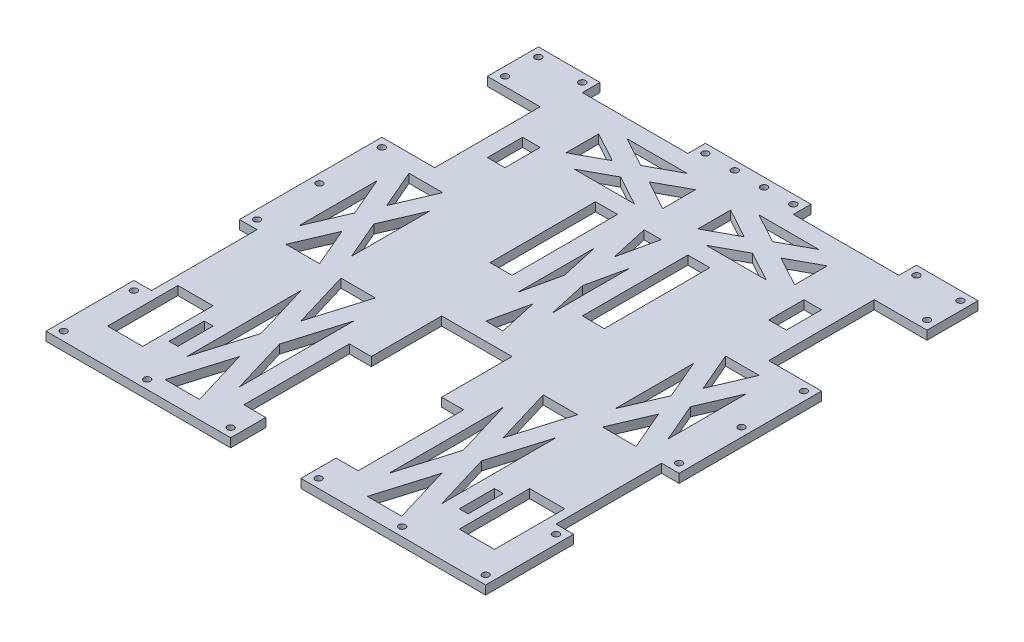
from build123d import *

# Parameters (mm, degrees)
SKETCH1_W           = 317.5
SKETCH1_H           = 355.6
BOSS_EXTRUDE1_DEPTH = 6.35
SKETCH2_W           = 50.8
SKETCH2_H           = 152.4
CUT_EXTRUDE1_DEPTH  = 239.442288615
SKETCH3_W           = 25.4
SKETCH3_H           = 76.2
SKETCH3_W_2         = 12.7
SKETCH3_H_2         = 25.4
CUT_EXTRUDE2_DEPTH  = 239.442288615
SKETCH4_W           = 12.7
SKETCH4_H           = 76.2
SKETCH4_W_2         = 76.2
SKETCH4_H_2         = 12.7
SKETCH4_W_3         = 15.875
CUT_EXTRUDE3_DEPTH  = 239.442288615
SKETCH5_W           = 25.4
SKETCH5_H           = 50.8
SKETCH5_W_2         = 6.35
SKETCH5_H_2         = 25.4
CUT_EXTRUDE4_DEPTH  = 239.442288615
SKETCH7_R           = 2.413
CUT_EXTRUDE6_DEPTH  = 239.442288615


with BuildPart() as part:
    # Sketch1 → Boss-Extrude1 (new body)
    with BuildSketch(Plane(origin=(0, 0, 0), x_dir=(1, 0, 0), z_dir=(0, 1, 0))):
        Rectangle(SKETCH1_W, SKETCH1_H)
    extrude(amount=BOSS_EXTRUDE1_DEPTH)

    # Sketch2 → Cut-Extrude1 (cut, through all)
    with BuildSketch(Plane(origin=(0, 6.35, 0), x_dir=(1, 0, 0), z_dir=(0, 1, 0))):
        with Locations((0, -101.6)):
            Rectangle(SKETCH2_W, SKETCH2_H)
    extrude(amount=-CUT_EXTRUDE1_DEPTH, mode=Mode.SUBTRACT)

    # Sketch3 → Cut-Extrude2 (cut, through all)
    with BuildSketch(Plane(origin=(0, 6.35, 0), x_dir=(1, 0, 0), z_dir=(0, 1, 0))):
        with Locations((133.35, 102.87)):
            Rectangle(SKETCH3_W, SKETCH3_H)
        with Locations((101.6, 102.87)):
            Rectangle(SKETCH3_W_2, SKETCH3_H_2)
        with Locations((-101.6, 102.87)):
            Rectangle(SKETCH3_W_2, SKETCH3_H_2)
        with Locations((-133.35, 102.87)):
            Rectangle(SKETCH3_W, SKETCH3_H)
    extrude(amount=-CUT_EXTRUDE2_DEPTH, mode=Mode.SUBTRACT)

    # Sketch4 → Cut-Extrude3 (cut, through all)
    with BuildSketch(Plane(origin=(0, 6.35, 0), x_dir=(1, 0, 0), z_dir=(0, 1, 0))):
        with Locations((-152.4, 102.87)):
            Rectangle(SKETCH4_W, SKETCH4_H)
        with Locations((-152.4, -76.2)):
            Rectangle(SKETCH4_W, SKETCH4_H)
        with Locations((152.4, 102.87)):
            Rectangle(SKETCH4_W, SKETCH4_H)
        with Locations((152.4, -76.2)):
            Rectangle(SKETCH4_W, SKETCH4_H)
        with Locations((76.2, 171.45)):
            Rectangle(SKETCH4_W_2, SKETCH4_H_2)
        with Locations((-76.2, 171.45)):
            Rectangle(SKETCH4_W_2, SKETCH4_H_2)
        with Locations((-33.3375, -114.3)):
            Rectangle(SKETCH4_W_3, SKETCH4_H)
        with Locations((33.3375, 63.5)):
            Rectangle(SKETCH4_W_3, SKETCH4_H)
        with Locations((-33.3375, 63.5)):
            Rectangle(SKETCH4_W_3, SKETCH4_H)
        with Locations((33.3375, -114.3)):
            Rectangle(SKETCH4_W_3, SKETCH4_H)
    extrude(amount=-CUT_EXTRUDE3_DEPTH, mode=Mode.SUBTRACT)

    # Sketch5 → Cut-Extrude4 (cut, through all)
    with BuildSketch(Plane(origin=(0, 6.35, 0), x_dir=(1, 0, 0), z_dir=(0, 1, 0))):
        Polygon((-73.025, -123.698648777), (-85.445405367, -165.1), (-60.604594633, -165.1), align=None)
        Polygon((-92.075, -60.198648777), (-92.075, -143.001351223), (-79.654594633, -101.6), align=None)
        Polygon((-53.975, -60.198648777), (-66.395405367, -101.6), (-53.975, -143.001351223), align=None)
        Polygon((-85.445405367, -38.1), (-73.025, -79.501351223), (-60.604594633, -38.1), align=None)
        Polygon((-114.3, -8.500053074), (-126.441405825, -36.83), (-102.158594175, -36.83), align=None)
        Polygon((-133.35, 35.949946926), (-133.35, -20.709946926), (-121.208594175, 7.62), align=None)
        Polygon((-95.25, 35.949946926), (-107.391405825, 7.62), (-95.25, -20.709946926), align=None)
        Polygon((-126.441405825, 52.07), (-114.3, 23.740053074), (-102.158594175, 52.07), align=None)
        Polygon((-47.625, 126.116793459), (-69.289121342, 114.3), (-25.960878658, 114.3), align=None)
        Polygon((-82.55, 145.166793459), (-82.55, 121.533206541), (-60.885878658, 133.35), align=None)
        Polygon((-12.7, 145.166793459), (-34.364121342, 133.35), (-12.7, 121.533206541), align=None)
        Polygon((-69.289121342, 152.4), (-47.625, 140.583206541), (-25.960878658, 152.4), align=None)
        Polygon((0, 15.177946348), (-6.195099188, -12.7), (6.195099188, -12.7), align=None)
        Polygon((-12.7, 72.327946348), (-12.7, 16.572053652), (-6.504900812, 44.45), align=None)
        Polygon((12.7, 72.327946348), (6.504900812, 44.45), (12.7, 16.572053652), align=None)
        Polygon((-6.195099188, 101.6), (0, 73.722053652), (6.195099188, 101.6), align=None)
        with Locations((-127, -127)):
            Rectangle(SKETCH5_W, SKETCH5_H)
        with Locations((-104.775, -127)):
            Rectangle(SKETCH5_W_2, SKETCH5_H_2)
    cut_extrude4 = extrude(amount=-CUT_EXTRUDE4_DEPTH, mode=Mode.SUBTRACT)

    # Mirror1: Cut-Extrude4 across plane
    add(cut_extrude4.mirror(Plane(origin=(0, 0, 0), x_dir=(0, 0, 1), z_dir=(1, 0, 0))), mode=Mode.SUBTRACT)

    # Sketch7 → Cut-Extrude6 (cut, through all)
    with BuildSketch(Plane(origin=(0, 6.35, 0), x_dir=(1, 0, 0), z_dir=(0, 1, 0))):
        with Locations((-152.4, -171.45)):
            Circle(SKETCH7_R)
        with Locations((-152.4, 171.45)):
            Circle(SKETCH7_R)
        with Locations((-120.65, 171.45)):
            Circle(SKETCH7_R)
        with Locations((-152.4, 147.32)):
            Circle(SKETCH7_R)
        with Locations((-31.75, 171.45)):
            Circle(SKETCH7_R)
        with Locations((-10.583333333, 171.45)):
            Circle(SKETCH7_R)
        with Locations((10.583333333, 171.45)):
            Circle(SKETCH7_R)
        with Locations((31.75, 171.45)):
            Circle(SKETCH7_R)
        with Locations((-31.75, -171.45)):
            Circle(SKETCH7_R)
        with Locations((-92.075, -171.45)):
            Circle(SKETCH7_R)
        with Locations((-152.4, -120.65)):
            Circle(SKETCH7_R)
        with Locations((-152.4, -31.75)):
            Circle(SKETCH7_R)
        with Locations((-152.4, 58.42)):
            Circle(SKETCH7_R)
        with Locations((-152.4, 13.335)):
            Circle(SKETCH7_R)
        with Locations((31.75, -171.45)):
            Circle(SKETCH7_R)
        with Locations((152.4, 13.335)):
            Circle(SKETCH7_R)
        with Locations((152.4, 58.42)):
            Circle(SKETCH7_R)
        with Locations((152.4, -31.75)):
            Circle(SKETCH7_R)
        with Locations((152.4, -120.65)):
            Circle(SKETCH7_R)
        with Locations((92.075, -171.45)):
            Circle(SKETCH7_R)
        with Locations((152.4, 147.32)):
            Circle(SKETCH7_R)
        with Locations((120.65, 171.45)):
            Circle(SKETCH7_R)
        with Locations((152.4, 171.45)):
            Circle(SKETCH7_R)
        with Locations((152.4, -171.45)):
            Circle(SKETCH7_R)
    extrude(amount=-CUT_EXTRUDE6_DEPTH, mode=Mode.SUBTRACT)


solid = part.part
